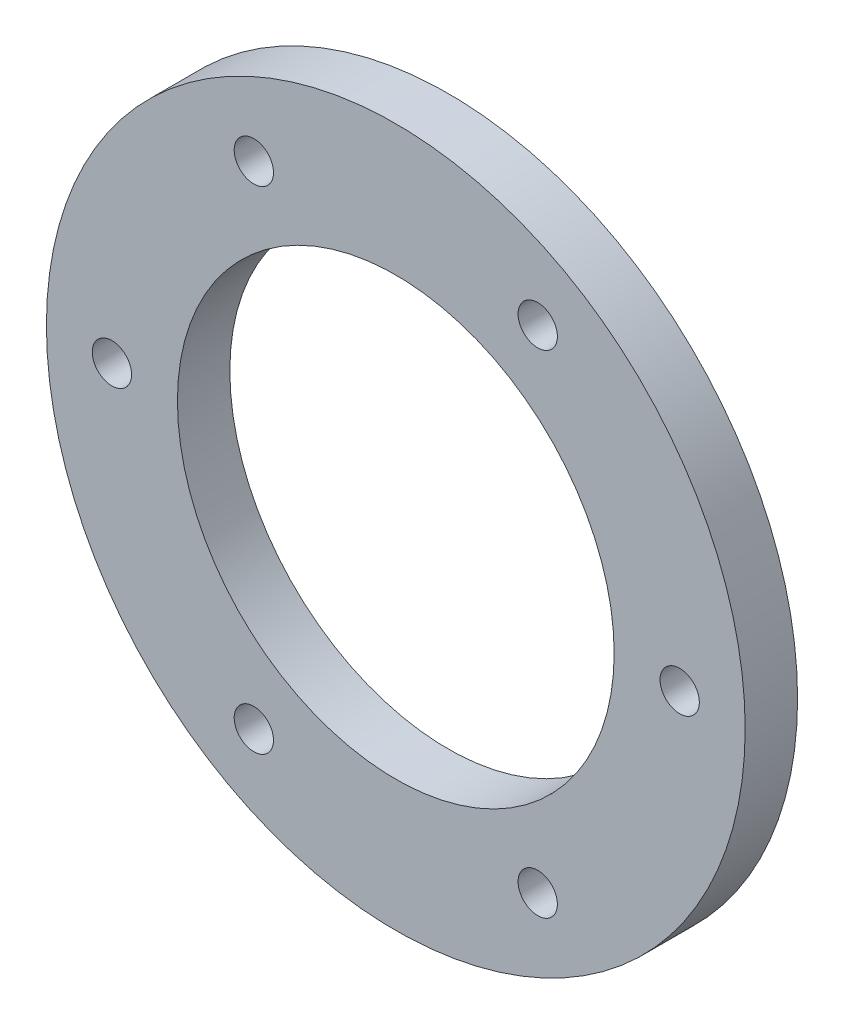
from build123d import *

# Parameters (mm, degrees)
SKETCH1_R           = 40
SKETCH1_R_2         = 25
BOSS_EXTRUDE1_DEPTH = 6
SKETCH2_R           = 2.25
CUT_EXTRUDE1_DEPTH  = 57.885850613
CIRPATTERN1_COUNT   = 6


with BuildPart() as part:
    # Sketch1 → Boss-Extrude1 (new body)
    with BuildSketch(Plane.XY):
        Circle(SKETCH1_R)
        Circle(SKETCH1_R_2, mode=Mode.SUBTRACT)
    extrude(amount=BOSS_EXTRUDE1_DEPTH)

    # Sketch2 → Cut-Extrude1 (cut, through all)
    with BuildSketch(Plane.XY):
        with Locations((-16.25, 28.145825623)):
            Circle(SKETCH2_R)
    cut_extrude1 = extrude(amount=CUT_EXTRUDE1_DEPTH, mode=Mode.SUBTRACT)

    # CirPattern1: Cut-Extrude1 ×6 about axis
    cirpattern1_axis = Axis((0, 0, 6), (0, 0, 1))
    for i in range(1, CIRPATTERN1_COUNT):
        add(cut_extrude1.rotate(cirpattern1_axis, i * 360 / CIRPATTERN1_COUNT), mode=Mode.SUBTRACT)


solid = part.part
